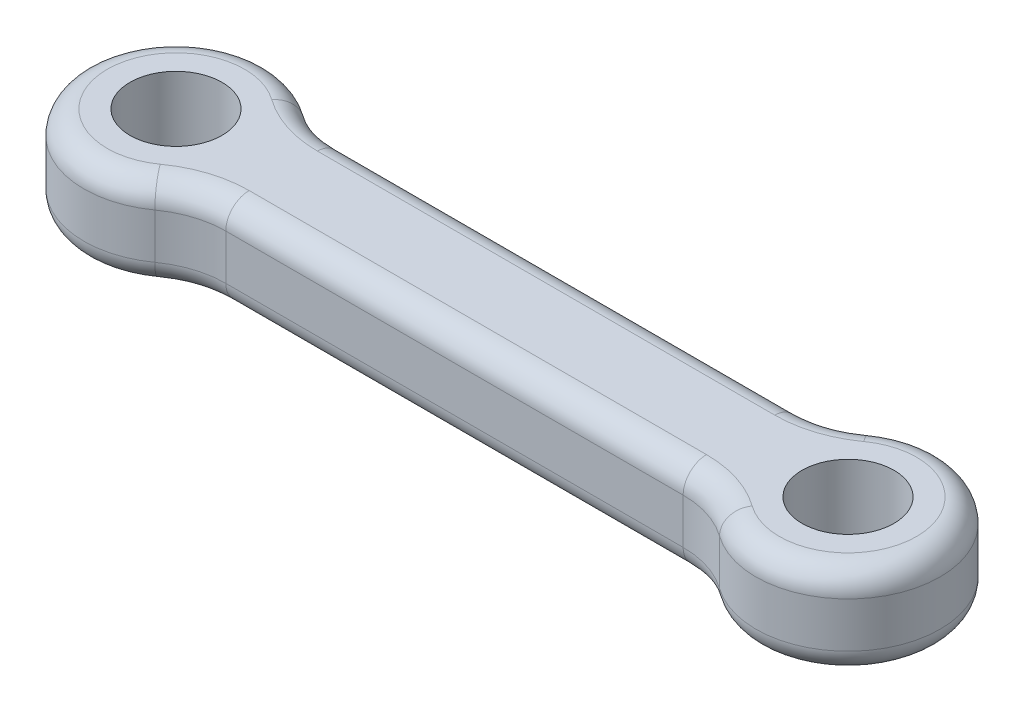
from build123d import *

# Parameters (mm, degrees)
SKETCH1_R           = 5
BOSS_EXTRUDE1_DEPTH = 10
FILLET1_R           = 2.54
SCALE1_SCALE        = 0.66


with BuildPart() as part:
    # Sketch1 → Boss-Extrude1 (new body)
    with BuildSketch(Plane(origin=(0, 0, 0), x_dir=(1, 0, 0), z_dir=(0, 1, 0))):
        with BuildLine():
            Line((-6.590776184, -6.25), (43.090776184, -6.25))
            ThreePointArc((43.090776184, -6.25), (46.152638362, -6.730283618), (48.920388092, -8.125))
            ThreePointArc((48.920388092, -8.125), (64.75, 0), (48.920388092, 8.125))
            ThreePointArc((48.920388092, 8.125), (46.152638362, 6.730283618), (43.090776184, 6.25))
            Line((43.090776184, 6.25), (-6.590776184, 6.25))
            ThreePointArc((-6.590776184, 6.25), (-9.652638362, 6.730283618), (-12.420388092, 8.125))
            ThreePointArc((-12.420388092, 8.125), (-28.25, 0), (-12.420388092, -8.125))
            ThreePointArc((-12.420388092, -8.125), (-9.652638362, -6.730283618), (-6.590776184, -6.25))
        make_face()
        with Locations((-18.25, 0)):
            Circle(SKETCH1_R, mode=Mode.SUBTRACT)
        with Locations((54.75, 0)):
            Circle(SKETCH1_R, mode=Mode.SUBTRACT)
    extrude(amount=BOSS_EXTRUDE1_DEPTH)

    # Fillet1
    fillet1_edges = [part.edges().sort_by_distance(p)[0] for p in [
        (-28.25, 0, 0),
        (-9.652638362, 0, 6.730283618),
        (18.25, 0, 6.25),
        (46.152638362, 0, 6.730283618),
        (64.75, 0, 0),
        (46.152638362, 0, -6.730283618),
        (18.25, 0, -6.25),
        (-9.652638362, 0, -6.730283618),
        (18.25, 10, -6.25),
        (46.152638362, 10, -6.730283618),
        (64.75, 10, 0),
        (46.152638362, 10, 6.730283618),
        (18.25, 10, 6.25),
        (-9.652638362, 10, 6.730283618),
        (-28.25, 10, 0),
        (-9.652638362, 10, -6.730283618),
    ]]
    fillet(fillet1_edges, radius=FILLET1_R)


with BuildPart() as part_1:
    # Scale1: scaled about (18.25, 5, 0)
    add(part.part.scale(SCALE1_SCALE).moved(Location((6.205, 1.7, 0))))


solid = part_1.part
